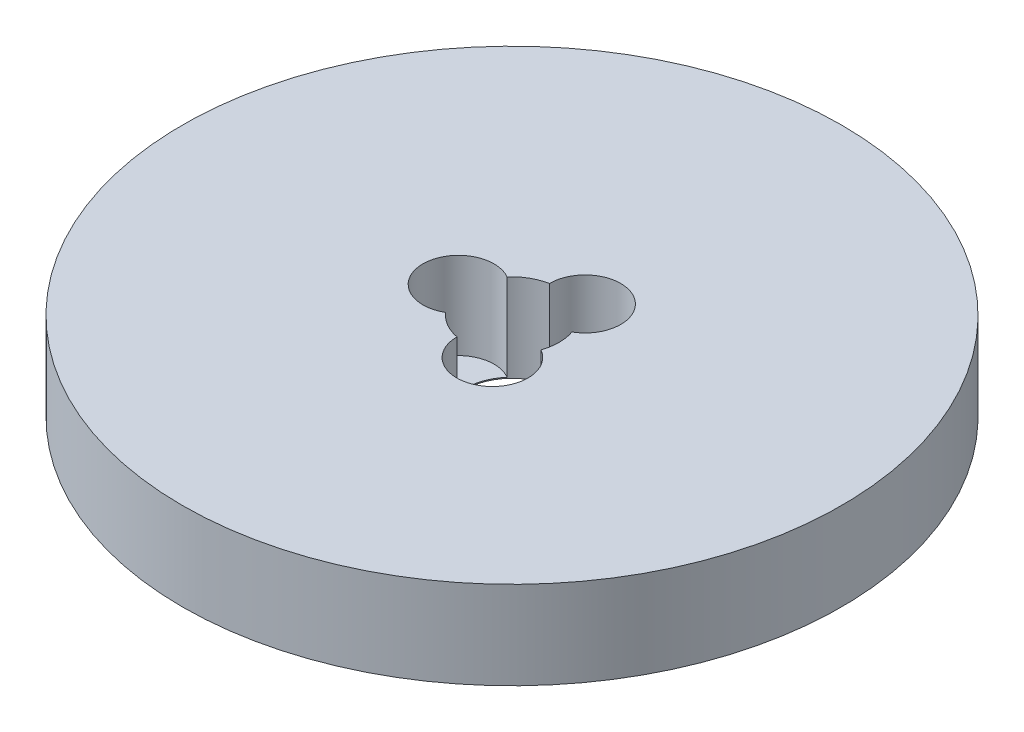
from build123d import *

# Parameters (mm, degrees)
SKETCH1_R           = 52.5
BOSS_EXTRUDE1_DEPTH = 14
SKETCH2_R           = 7.5
CUT_EXTRUDE1_DEPTH  = 76.554616007
SKETCH3_R           = 5.668376364
CUT_EXTRUDE2_DEPTH  = 13.837663529
CIRPATTERN1_COUNT   = 3


with BuildPart() as part:
    # Sketch1 → Boss-Extrude1 (new body)
    with BuildSketch(Plane(origin=(0, 0, 0), x_dir=(1, 0, 0), z_dir=(0, 1, 0))):
        Circle(SKETCH1_R)
    extrude(amount=BOSS_EXTRUDE1_DEPTH)

    # Sketch2 → Cut-Extrude1 (cut, through all)
    with BuildSketch(Plane(origin=(0, 0, 0), x_dir=(1, 0, 0), z_dir=(0, 1, 0))):
        Circle(SKETCH2_R)
    extrude(amount=CUT_EXTRUDE1_DEPTH, mode=Mode.SUBTRACT)

    # Sketch3 → Cut-Extrude2 (cut)
    with BuildSketch(Plane(origin=(0, 14, 0), x_dir=(1, 0, 0), z_dir=(0, 1, 0))):
        with Locations((-8.528421986, 0)):
            Circle(SKETCH3_R)
    cut_extrude2 = extrude(amount=-CUT_EXTRUDE2_DEPTH, mode=Mode.SUBTRACT)

    # CirPattern1: Cut-Extrude2 ×3 about axis
    cirpattern1_axis = Axis((0, 0, 0), (0, 1, 0))
    for i in range(1, CIRPATTERN1_COUNT):
        add(cut_extrude2.rotate(cirpattern1_axis, i * 360 / CIRPATTERN1_COUNT), mode=Mode.SUBTRACT)


solid = part.part
